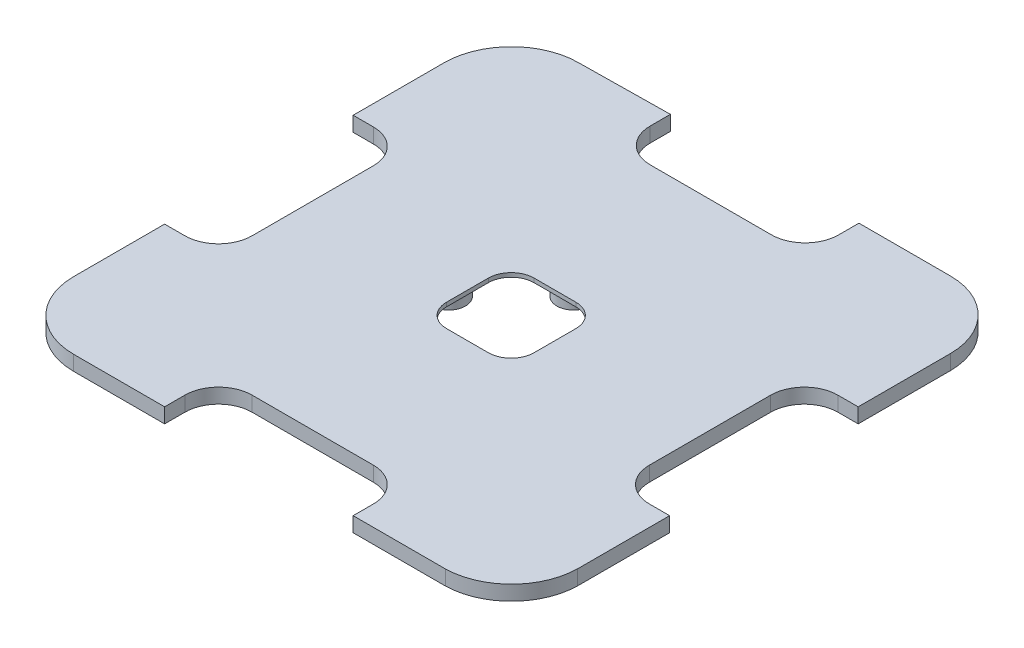
from build123d import *

# Parameters (mm, degrees)
SKETCH6_R           = 4.1
SKETCH6_R_2         = 1.85
SKETCH6_R_3         = 4
SKETCH6_R_4         = 5
BOSS_EXTRUDE3_DEPTH = 3.2
BOSS_EXTRUDE4_DEPTH = 1.2


with BuildPart() as part:
    # Sketch6 → Boss-Extrude3 (new body)
    # profile 1 of 85: a face of its own
    with BuildSketch(Plane(origin=(0, 0, 0), x_dir=(1, 0, 0), z_dir=(0, 1, 0))):
        with BuildLine():
            Line((-54.954364554, -74.989433444), (-27.954319602, -74.989433444))
            Line((-27.954319602, -74.989433444), (-27.954319602, -68.989433444))
            ThreePointArc((-27.954319602, -68.989433444), (-25.025387413, -61.918365632), (-17.954319602, -58.989433444))
            Line((-17.954319602, -58.989433444), (18.045680398, -58.989433444))
            ThreePointArc((18.045680398, -58.989433444), (25.11674821, -61.918365632), (28.045680398, -68.989433444))
            Line((28.045680398, -68.989433444), (28.045680398, -74.989433444))
            Line((28.045680398, -74.989433444), (55.511873427, -74.989433444))
            ThreePointArc((55.511873427, -74.989433444), (69.206726349, -69.094868813), (75.045680398, -55.376213472))
            Line((75.045680398, -55.376213472), (75.045680398, -27.989433444))
            Line((75.045680398, -27.989433444), (69.045680398, -27.989433444))
            ThreePointArc((69.045680398, -27.989433444), (61.974612587, -25.060501256), (59.045680398, -17.989433444))
            Line((59.045680398, -17.989433444), (59.045680398, 18.010566556))
            ThreePointArc((59.045680398, 18.010566556), (61.974612587, 25.081634368), (69.045680398, 28.010566556))
            Line((69.045680398, 28.010566556), (75.045680398, 28.010566556))
            Line((75.045680398, 28.010566556), (75.045680398, 55.370032289))
            ThreePointArc((75.045680398, 55.370032289), (69.187427099, 69.512575445), (55.04457266, 75.370077213))
            Line((55.04457266, 75.370077213), (27.921982461, 75.368635939))
            Line((27.921982461, 75.368635939), (27.922301297, 69.368635948))
            ThreePointArc((27.922301297, 69.368635948), (24.993744864, 62.297412505), (17.922832703, 59.36810457))
            Line((17.922832703, 59.36810457), (-18.077167246, 59.366191558))
            ThreePointArc((-18.077167246, 59.366191558), (-23.798086545, 61.163925869), (-27.461910519, 65.91125777))
            ThreePointArc((-27.461910519, 65.91125777), (-27.922501398, 67.611238944), (-28.077698624, 69.365660152))
            Line((-28.077698624, 69.365660152), (-28.07801746, 75.365660143))
            Line((-28.07801746, 75.365660143), (-54.92145734, 75.00005628))
            ThreePointArc((-54.92145734, 75.00005628), (-69.084833934, 69.153857035), (-74.954319602, 55.000114768))
            Line((-74.954319602, 55.000114768), (-74.954319602, 28.010566556))
            Line((-74.954319602, 28.010566556), (-68.954319602, 28.010566556))
            ThreePointArc((-68.954319602, 28.010566556), (-61.88325179, 25.081634368), (-58.954319602, 18.010566556))
            Line((-58.954319602, 18.010566556), (-58.954319602, -17.989433444))
            ThreePointArc((-58.954319602, -17.989433444), (-61.88325179, -25.060501256), (-68.954319602, -27.989433444))
            Line((-68.954319602, -27.989433444), (-74.954319602, -27.989433444))
            Line((-74.954319602, -27.989433444), (-74.954319602, -54.989478396))
            ThreePointArc((-74.954319602, -54.989478396), (-69.096468391, -69.131582234), (-54.954364554, -74.989433444))
        make_face()
        with BuildLine():
            Line((-73.454319602, 29.510566556), (-73.454319602, 55.000114768))
            ThreePointArc((-73.454319602, 55.000114768), (-68.021074061, 68.096289551), (-54.912699994, 73.500036434))
            Line((-54.912699994, 73.500036434), (-29.57793666, 73.845092336))
            Line((-29.57793666, 73.845092336), (-29.577698622, 69.365580443))
            ThreePointArc((-29.577698622, 69.365580443), (-26.208994497, 61.234031458), (-18.077087537, 57.86619156))
            Line((-18.077087537, 57.86619156), (17.922912412, 57.868104572))
            ThreePointArc((17.922912412, 57.868104572), (26.054461397, 61.236808697), (29.422301295, 69.368715657))
            Line((29.422301295, 69.368715657), (29.422062168, 73.86871565))
            Line((29.422062168, 73.86871565), (55.044652369, 73.870077215))
            ThreePointArc((55.044652369, 73.870077215), (68.126795109, 68.451887093), (73.545680398, 55.370032289))
            Line((73.545680398, 55.370032289), (73.545680398, 29.510566556))
            Line((73.545680398, 29.510566556), (69.045680398, 29.510566556))
            ThreePointArc((69.045680398, 29.510566556), (60.913952415, 26.142294539), (57.545680398, 18.010566556))
            Line((57.545680398, 18.010566556), (57.545680398, -17.989433444))
            ThreePointArc((57.545680398, -17.989433444), (60.913952415, -26.121161428), (69.045680398, -29.489433444))
            Line((69.045680398, -29.489433444), (73.545680398, -29.489433444))
            Line((73.545680398, -29.489433444), (73.545680398, -55.359832298))
            ThreePointArc((73.545680398, -55.359832298), (68.144969601, -68.035305217), (55.492389781, -73.489433444))
            Line((55.492389781, -73.489433444), (29.545680398, -73.489433444))
            Line((29.545680398, -73.489433444), (29.545680398, -68.989433444))
            ThreePointArc((29.545680398, -68.989433444), (26.177408382, -60.857705461), (18.045680398, -57.489433444))
            Line((18.045680398, -57.489433444), (-17.954319602, -57.489433444))
            ThreePointArc((-17.954319602, -57.489433444), (-26.086047585, -60.857705461), (-29.454319602, -68.989433444))
            Line((-29.454319602, -68.989433444), (-29.454319602, -73.489433444))
            Line((-29.454319602, -73.489433444), (-54.954364554, -73.489433444))
            ThreePointArc((-54.954364554, -73.489433444), (-68.03580822, -68.070922062), (-73.454319602, -54.989478396))
            Line((-73.454319602, -54.989478396), (-73.454319602, -29.489433444))
            Line((-73.454319602, -29.489433444), (-68.954319602, -29.489433444))
            ThreePointArc((-68.954319602, -29.489433444), (-60.822591618, -26.121161428), (-57.454319602, -17.989433444))
            Line((-57.454319602, -17.989433444), (-57.454319602, 18.010566556))
            ThreePointArc((-57.454319602, 18.010566556), (-60.822591618, 26.142294539), (-68.954319602, 29.510566556))
            Line((-68.954319602, 29.510566556), (-73.454319602, 29.510566556))
        make_face(mode=Mode.SUBTRACT)
    # profile 2 of 85: a face of its own
    with BuildSketch(Plane(origin=(0, 0, 0), x_dir=(1, 0, 0), z_dir=(0, 1, 0))):
        with BuildLine():
            ThreePointArc((-55.258923492, 58.988516932), (-57.040422597, 68.824154739), (-55.840270587, 58.900791132))
            ThreePointArc((-55.840270587, 58.900791132), (-57.747454065, 57.863456958), (-58.831826365, 55.982619985))
            ThreePointArc((-58.831826365, 55.982619985), (-68.753088955, 57.180513649), (-58.945846361, 55.261036292))
            ThreePointArc((-58.945846361, 55.261036292), (-52.110508104, 52.187215135), (-55.258923492, 58.988516932))
        make_face()
        with Locations((-63.814364554, 56.400128304)):
            Circle(SKETCH6_R, mode=Mode.SUBTRACT)
        with Locations((-54.954364554, 55.000128304)):
            Circle(SKETCH6_R_2, mode=Mode.SUBTRACT)
        with Locations((-56.294364554, 63.880128304)):
            Circle(SKETCH6_R, mode=Mode.SUBTRACT)
    # profile 3 of 85: a face of its own
    with BuildSketch(Plane(origin=(0, 0, 0), x_dir=(1, 0, 0), z_dir=(0, 1, 0))):
        with Locations((-17.000044952, 17.000224653)):
            Circle(SKETCH6_R_3)
        with Locations((-17.000044952, 17.000224653)):
            Circle(SKETCH6_R_2, mode=Mode.SUBTRACT)
    # profile 4 of 85: a face of its own
    with BuildSketch(Plane(origin=(0, 0, 0), x_dir=(1, 0, 0), z_dir=(0, 1, 0))):
        with Locations((-17.000044952, -16.999775347)):
            Circle(SKETCH6_R_3)
        with Locations((-17.000044952, -16.999775347)):
            Circle(SKETCH6_R_2, mode=Mode.SUBTRACT)
    # profile 5 of 85: a face of its own
    with BuildSketch(Plane(origin=(0, 0, 0), x_dir=(1, 0, 0), z_dir=(0, 1, 0))):
        with BuildLine():
            ThreePointArc((-55.938318133, -58.86654832), (-57.134773065, -68.787929532), (-55.213798486, -58.98103572))
            ThreePointArc((-55.213798486, -58.98103572), (-52.141894921, -52.145212163), (-58.94275318, -55.29376773))
            ThreePointArc((-58.94275318, -55.29376773), (-68.778413132, -57.075120071), (-58.855000429, -55.875410449))
            ThreePointArc((-58.855000429, -55.875410449), (-57.818195899, -57.782023089), (-55.938318133, -58.86654832))
        make_face()
        with Locations((-56.354364552, -63.849208791)):
            Circle(SKETCH6_R, mode=Mode.SUBTRACT)
        with Locations((-63.834364552, -56.329208791)):
            Circle(SKETCH6_R, mode=Mode.SUBTRACT)
        with Locations((-54.954364554, -54.989478396)):
            Circle(SKETCH6_R_2, mode=Mode.SUBTRACT)
    # profile 6 of 85: a face of its own
    with BuildSketch(Plane(origin=(0, 0, 0), x_dir=(1, 0, 0), z_dir=(0, 1, 0))):
        with Locations((16.999955048, -16.999775347)):
            Circle(SKETCH6_R_3)
        with Locations((16.999955048, -16.999775347)):
            Circle(SKETCH6_R_2, mode=Mode.SUBTRACT)
    # profile 7 of 85: a face of its own
    with BuildSketch(Plane(origin=(0, 0, 0), x_dir=(1, 0, 0), z_dir=(0, 1, 0))):
        with BuildLine():
            ThreePointArc((55.305652161, -58.935094765), (57.087176889, -68.770728706), (55.886947644, -58.847373672))
            ThreePointArc((55.886947644, -58.847373672), (57.794231807, -57.809945824), (58.878576703, -55.928939294))
            ThreePointArc((58.878576703, -55.928939294), (68.799818323, -57.127087058), (58.992513893, -55.207875457))
            ThreePointArc((58.992513893, -55.207875457), (52.15726306, -52.13371556), (55.305652161, -58.935094765))
        make_face()
        with Locations((56.341093222, -63.826706137)):
            Circle(SKETCH6_R, mode=Mode.SUBTRACT)
        with Locations((63.861093222, -56.346706137)):
            Circle(SKETCH6_R, mode=Mode.SUBTRACT)
        with Locations((55.001046261, -54.946706852)):
            Circle(SKETCH6_R_2, mode=Mode.SUBTRACT)
    # profile 8 of 85: a face of its own
    with BuildSketch(Plane(origin=(0, 0, 0), x_dir=(1, 0, 0), z_dir=(0, 1, 0))):
        with Locations((16.999955048, 17.000224653)):
            Circle(SKETCH6_R_3)
        with Locations((16.999955048, 17.000224653)):
            Circle(SKETCH6_R_2, mode=Mode.SUBTRACT)
    # profile 9 of 85: a face of its own
    with BuildSketch(Plane(origin=(0, 0, 0), x_dir=(1, 0, 0), z_dir=(0, 1, 0))):
        with BuildLine():
            ThreePointArc((56.028127127, 59.2474941), (57.226020792, 69.16875669), (55.306543434, 59.361514097))
            ThreePointArc((55.306543434, 59.361514097), (52.232722278, 52.526175839), (59.034024075, 55.674591228))
            ThreePointArc((59.034024075, 55.674591228), (68.869661882, 57.456090332), (58.946298275, 56.255938322))
            ThreePointArc((58.946298275, 56.255938322), (57.908964101, 58.1631218), (56.028127127, 59.2474941))
        make_face()
        with Locations((55.045635446, 55.370032289)):
            Circle(SKETCH6_R_2, mode=Mode.SUBTRACT)
        with Locations((63.925635446, 56.710032289)):
            Circle(SKETCH6_R, mode=Mode.SUBTRACT)
        with Locations((56.445635446, 64.230032289)):
            Circle(SKETCH6_R, mode=Mode.SUBTRACT)
    # profile 10 of 85: a face of its own
    with BuildSketch(Plane(origin=(0, 0, 0), x_dir=(1, 0, 0), z_dir=(0, 1, 0))):
        with Locations((-45.500044952, 65.000224653)):
            Circle(SKETCH6_R_4)
        with Locations((-45.500044952, 65.000224653)):
            Circle(SKETCH6_R, mode=Mode.SUBTRACT)
    # profile 11 of 85: a face of its own
    with BuildSketch(Plane(origin=(0, 0, 0), x_dir=(1, 0, 0), z_dir=(0, 1, 0))):
        with Locations((-33.770044952, 60.560224653)):
            Circle(SKETCH6_R_4)
        with Locations((-33.770044952, 60.560224653)):
            Circle(SKETCH6_R, mode=Mode.SUBTRACT)
    # profile 12 of 85: a face of its own
    with BuildSketch(Plane(origin=(0, 0, 0), x_dir=(1, 0, 0), z_dir=(0, 1, 0))):
        with Locations((-22.730044952, 52.090224653)):
            Circle(SKETCH6_R_4)
        with Locations((-22.730044952, 52.090224653)):
            Circle(SKETCH6_R, mode=Mode.SUBTRACT)
    # profile 13 of 85: a face of its own
    with BuildSketch(Plane(origin=(0, 0, 0), x_dir=(1, 0, 0), z_dir=(0, 1, 0))):
        with Locations((-10.970044952, 52.090224653)):
            Circle(SKETCH6_R_4)
        with Locations((-10.970044952, 52.090224653)):
            Circle(SKETCH6_R, mode=Mode.SUBTRACT)
    # profile 14 of 85: a face of its own
    with BuildSketch(Plane(origin=(0, 0, 0), x_dir=(1, 0, 0), z_dir=(0, 1, 0))):
        with Locations((-4.4952e-05, 52.090224653)):
            Circle(SKETCH6_R_4)
        with Locations((-4.4952e-05, 52.090224653)):
            Circle(SKETCH6_R, mode=Mode.SUBTRACT)
    # profile 15 of 85: a face of its own
    with BuildSketch(Plane(origin=(0, 0, 0), x_dir=(1, 0, 0), z_dir=(0, 1, 0))):
        with Locations((10.969955048, 52.090224653)):
            Circle(SKETCH6_R_4)
        with Locations((10.969955048, 52.090224653)):
            Circle(SKETCH6_R, mode=Mode.SUBTRACT)
    # profile 16 of 85: a face of its own
    with BuildSketch(Plane(origin=(0, 0, 0), x_dir=(1, 0, 0), z_dir=(0, 1, 0))):
        with Locations((33.859955048, 60.620224653)):
            Circle(SKETCH6_R_4)
        with Locations((33.859955048, 60.620224653)):
            Circle(SKETCH6_R, mode=Mode.SUBTRACT)
    # profile 17 of 85: a face of its own
    with BuildSketch(Plane(origin=(0, 0, 0), x_dir=(1, 0, 0), z_dir=(0, 1, 0))):
        with Locations((45.569955048, 65.000224653)):
            Circle(SKETCH6_R_4)
        with Locations((45.569955048, 65.000224653)):
            Circle(SKETCH6_R, mode=Mode.SUBTRACT)
    # profile 18 of 85: a face of its own
    with BuildSketch(Plane(origin=(0, 0, 0), x_dir=(1, 0, 0), z_dir=(0, 1, 0))):
        with Locations((64.999955048, 45.500224653)):
            Circle(SKETCH6_R_4)
        with Locations((64.999955048, 45.500224653)):
            Circle(SKETCH6_R, mode=Mode.SUBTRACT)
    # profile 19 of 85: a face of its own
    with BuildSketch(Plane(origin=(0, 0, 0), x_dir=(1, 0, 0), z_dir=(0, 1, 0))):
        with Locations((47.059955048, 47.060224653)):
            Circle(SKETCH6_R_4)
        with Locations((47.059955048, 47.060224653)):
            Circle(SKETCH6_R, mode=Mode.SUBTRACT)
    # profile 20 of 85: a face of its own
    with BuildSketch(Plane(origin=(0, 0, 0), x_dir=(1, 0, 0), z_dir=(0, 1, 0))):
        with Locations((39.629955048, 39.630224653)):
            Circle(SKETCH6_R_4)
        with Locations((39.629955048, 39.630224653)):
            Circle(SKETCH6_R, mode=Mode.SUBTRACT)
    # profile 21 of 85: a face of its own
    with BuildSketch(Plane(origin=(0, 0, 0), x_dir=(1, 0, 0), z_dir=(0, 1, 0))):
        with Locations((22.829955048, 52.090224653)):
            Circle(SKETCH6_R_4)
        with Locations((22.829955048, 52.090224653)):
            Circle(SKETCH6_R, mode=Mode.SUBTRACT)
    # profile 22 of 85: a face of its own
    with BuildSketch(Plane(origin=(0, 0, 0), x_dir=(1, 0, 0), z_dir=(0, 1, 0))):
        with Locations((13.309955048, 41.090224653)):
            Circle(SKETCH6_R_4)
        with Locations((13.309955048, 41.090224653)):
            Circle(SKETCH6_R, mode=Mode.SUBTRACT)
    # profile 23 of 85: a face of its own
    with BuildSketch(Plane(origin=(0, 0, 0), x_dir=(1, 0, 0), z_dir=(0, 1, 0))):
        with Locations((-4.4952e-05, 41.120224653)):
            Circle(SKETCH6_R_4)
        with Locations((-4.4952e-05, 41.120224653)):
            Circle(SKETCH6_R, mode=Mode.SUBTRACT)
    # profile 24 of 85: a face of its own
    with BuildSketch(Plane(origin=(0, 0, 0), x_dir=(1, 0, 0), z_dir=(0, 1, 0))):
        with Locations((-13.210044952, 40.960224653)):
            Circle(SKETCH6_R_4)
        with Locations((-13.210044952, 40.960224653)):
            Circle(SKETCH6_R, mode=Mode.SUBTRACT)
    # profile 25 of 85: a face of its own
    with BuildSketch(Plane(origin=(0, 0, 0), x_dir=(1, 0, 0), z_dir=(0, 1, 0))):
        with Locations((-5.580044952, 29.210224653)):
            Circle(SKETCH6_R_4)
        with Locations((-5.580044952, 29.210224653)):
            Circle(SKETCH6_R, mode=Mode.SUBTRACT)
    # profile 26 of 85: a face of its own
    with BuildSketch(Plane(origin=(0, 0, 0), x_dir=(1, 0, 0), z_dir=(0, 1, 0))):
        with Locations((5.679955048, 29.370224653)):
            Circle(SKETCH6_R_4)
        with Locations((5.679955048, 29.370224653)):
            Circle(SKETCH6_R, mode=Mode.SUBTRACT)
    # profile 27 of 85: a face of its own
    with BuildSketch(Plane(origin=(0, 0, 0), x_dir=(1, 0, 0), z_dir=(0, 1, 0))):
        with Locations((-4.4952e-05, 18.580224653)):
            Circle(SKETCH6_R_4)
        with Locations((-4.4952e-05, 18.580224653)):
            Circle(SKETCH6_R, mode=Mode.SUBTRACT)
    # profile 28 of 85: a face of its own
    with BuildSketch(Plane(origin=(0, 0, 0), x_dir=(1, 0, 0), z_dir=(0, 1, 0))):
        with Locations((-47.060044952, 47.060224653)):
            Circle(SKETCH6_R_4)
        with Locations((-47.060044952, 47.060224653)):
            Circle(SKETCH6_R, mode=Mode.SUBTRACT)
    # profile 29 of 85: a face of its own
    with BuildSketch(Plane(origin=(0, 0, 0), x_dir=(1, 0, 0), z_dir=(0, 1, 0))):
        with Locations((-39.630044952, 39.630224653)):
            Circle(SKETCH6_R_4)
        with Locations((-39.630044952, 39.630224653)):
            Circle(SKETCH6_R, mode=Mode.SUBTRACT)
    # profile 30 of 85: a face of its own
    with BuildSketch(Plane(origin=(0, 0, 0), x_dir=(1, 0, 0), z_dir=(0, 1, 0))):
        with Locations((-32.200044952, 32.200224653)):
            Circle(SKETCH6_R_4)
        with Locations((-32.200044952, 32.200224653)):
            Circle(SKETCH6_R, mode=Mode.SUBTRACT)
    # profile 31 of 85: a face of its own
    with BuildSketch(Plane(origin=(0, 0, 0), x_dir=(1, 0, 0), z_dir=(0, 1, 0))):
        with Locations((-24.770044952, 24.770224653)):
            Circle(SKETCH6_R_4)
        with Locations((-24.770044952, 24.770224653)):
            Circle(SKETCH6_R, mode=Mode.SUBTRACT)
    # profile 32 of 85: a face of its own
    with BuildSketch(Plane(origin=(0, 0, 0), x_dir=(1, 0, 0), z_dir=(0, 1, 0))):
        with Locations((-65.000044952, 45.570224653)):
            Circle(SKETCH6_R_4)
        with Locations((-65.000044952, 45.570224653)):
            Circle(SKETCH6_R, mode=Mode.SUBTRACT)
    # profile 33 of 85: a face of its own
    with BuildSketch(Plane(origin=(0, 0, 0), x_dir=(1, 0, 0), z_dir=(0, 1, 0))):
        with Locations((-60.620044952, 33.860224653)):
            Circle(SKETCH6_R_4)
        with Locations((-60.620044952, 33.860224653)):
            Circle(SKETCH6_R, mode=Mode.SUBTRACT)
    # profile 34 of 85: a face of its own
    with BuildSketch(Plane(origin=(0, 0, 0), x_dir=(1, 0, 0), z_dir=(0, 1, 0))):
        with Locations((-52.090044952, 22.830224653)):
            Circle(SKETCH6_R_4)
        with Locations((-52.090044952, 22.830224653)):
            Circle(SKETCH6_R, mode=Mode.SUBTRACT)
    # profile 35 of 85: a face of its own
    with BuildSketch(Plane(origin=(0, 0, 0), x_dir=(1, 0, 0), z_dir=(0, 1, 0))):
        with Locations((-41.090044952, 13.310224653)):
            Circle(SKETCH6_R_4)
        with Locations((-41.090044952, 13.310224653)):
            Circle(SKETCH6_R, mode=Mode.SUBTRACT)
    # profile 36 of 85: a face of its own
    with BuildSketch(Plane(origin=(0, 0, 0), x_dir=(1, 0, 0), z_dir=(0, 1, 0))):
        with Locations((-52.090044952, 10.970224653)):
            Circle(SKETCH6_R_4)
        with Locations((-52.090044952, 10.970224653)):
            Circle(SKETCH6_R, mode=Mode.SUBTRACT)
    # profile 37 of 85: a face of its own
    with BuildSketch(Plane(origin=(0, 0, 0), x_dir=(1, 0, 0), z_dir=(0, 1, 0))):
        with Locations((-52.090044952, 0.000224653)):
            Circle(SKETCH6_R_4)
        with Locations((-52.090044952, 0.000224653)):
            Circle(SKETCH6_R, mode=Mode.SUBTRACT)
    # profile 38 of 85: a face of its own
    with BuildSketch(Plane(origin=(0, 0, 0), x_dir=(1, 0, 0), z_dir=(0, 1, 0))):
        with Locations((-41.120044952, 0.000224653)):
            Circle(SKETCH6_R_4)
        with Locations((-41.120044952, 0.000224653)):
            Circle(SKETCH6_R, mode=Mode.SUBTRACT)
    # profile 39 of 85: a face of its own
    with BuildSketch(Plane(origin=(0, 0, 0), x_dir=(1, 0, 0), z_dir=(0, 1, 0))):
        with Locations((-29.370044952, 5.680224653)):
            Circle(SKETCH6_R_4)
        with Locations((-29.370044952, 5.680224653)):
            Circle(SKETCH6_R, mode=Mode.SUBTRACT)
    # profile 40 of 85: a face of its own
    with BuildSketch(Plane(origin=(0, 0, 0), x_dir=(1, 0, 0), z_dir=(0, 1, 0))):
        with Locations((-18.580044952, 0.000224653)):
            Circle(SKETCH6_R_4)
        with Locations((-18.580044952, 0.000224653)):
            Circle(SKETCH6_R, mode=Mode.SUBTRACT)
    # profile 41 of 85: a face of its own
    with BuildSketch(Plane(origin=(0, 0, 0), x_dir=(1, 0, 0), z_dir=(0, 1, 0))):
        with Locations((-29.210044952, -5.579775347)):
            Circle(SKETCH6_R_4)
        with Locations((-29.210044952, -5.579775347)):
            Circle(SKETCH6_R, mode=Mode.SUBTRACT)
    # profile 42 of 85: a face of its own
    with BuildSketch(Plane(origin=(0, 0, 0), x_dir=(1, 0, 0), z_dir=(0, 1, 0))):
        with Locations((-40.960044952, -13.209775347)):
            Circle(SKETCH6_R_4)
        with Locations((-40.960044952, -13.209775347)):
            Circle(SKETCH6_R, mode=Mode.SUBTRACT)
    # profile 43 of 85: a face of its own
    with BuildSketch(Plane(origin=(0, 0, 0), x_dir=(1, 0, 0), z_dir=(0, 1, 0))):
        with Locations((-52.090044952, -10.969775347)):
            Circle(SKETCH6_R_4)
        with Locations((-52.090044952, -10.969775347)):
            Circle(SKETCH6_R, mode=Mode.SUBTRACT)
    # profile 44 of 85: a face of its own
    with BuildSketch(Plane(origin=(0, 0, 0), x_dir=(1, 0, 0), z_dir=(0, 1, 0))):
        with Locations((-52.090044952, -22.729775347)):
            Circle(SKETCH6_R_4)
        with Locations((-52.090044952, -22.729775347)):
            Circle(SKETCH6_R, mode=Mode.SUBTRACT)
    # profile 45 of 85: a face of its own
    with BuildSketch(Plane(origin=(0, 0, 0), x_dir=(1, 0, 0), z_dir=(0, 1, 0))):
        with Locations((-60.560044952, -33.769775347)):
            Circle(SKETCH6_R_4)
        with Locations((-60.560044952, -33.769775347)):
            Circle(SKETCH6_R, mode=Mode.SUBTRACT)
    # profile 46 of 85: a face of its own
    with BuildSketch(Plane(origin=(0, 0, 0), x_dir=(1, 0, 0), z_dir=(0, 1, 0))):
        with Locations((-65.000044952, -45.499775347)):
            Circle(SKETCH6_R_4)
        with Locations((-65.000044952, -45.499775347)):
            Circle(SKETCH6_R, mode=Mode.SUBTRACT)
    # profile 47 of 85: a face of its own
    with BuildSketch(Plane(origin=(0, 0, 0), x_dir=(1, 0, 0), z_dir=(0, 1, 0))):
        with Locations((-45.570044952, -64.999775347)):
            Circle(SKETCH6_R_4)
        with Locations((-45.570044952, -64.999775347)):
            Circle(SKETCH6_R, mode=Mode.SUBTRACT)
    # profile 48 of 85: a face of its own
    with BuildSketch(Plane(origin=(0, 0, 0), x_dir=(1, 0, 0), z_dir=(0, 1, 0))):
        with Locations((-47.060044952, -47.059775347)):
            Circle(SKETCH6_R_4)
        with Locations((-47.060044952, -47.059775347)):
            Circle(SKETCH6_R, mode=Mode.SUBTRACT)
    # profile 49 of 85: a face of its own
    with BuildSketch(Plane(origin=(0, 0, 0), x_dir=(1, 0, 0), z_dir=(0, 1, 0))):
        with Locations((-33.860044952, -60.619775347)):
            Circle(SKETCH6_R_4)
        with Locations((-33.860044952, -60.619775347)):
            Circle(SKETCH6_R, mode=Mode.SUBTRACT)
    # profile 50 of 85: a face of its own
    with BuildSketch(Plane(origin=(0, 0, 0), x_dir=(1, 0, 0), z_dir=(0, 1, 0))):
        with Locations((-22.830044952, -52.089775347)):
            Circle(SKETCH6_R_4)
        with Locations((-22.830044952, -52.089775347)):
            Circle(SKETCH6_R, mode=Mode.SUBTRACT)
    # profile 51 of 85: a face of its own
    with BuildSketch(Plane(origin=(0, 0, 0), x_dir=(1, 0, 0), z_dir=(0, 1, 0))):
        with Locations((-39.630044952, -39.629775347)):
            Circle(SKETCH6_R_4)
        with Locations((-39.630044952, -39.629775347)):
            Circle(SKETCH6_R, mode=Mode.SUBTRACT)
    # profile 52 of 85: a face of its own
    with BuildSketch(Plane(origin=(0, 0, 0), x_dir=(1, 0, 0), z_dir=(0, 1, 0))):
        with Locations((-32.200044952, -32.199775347)):
            Circle(SKETCH6_R_4)
        with Locations((-32.200044952, -32.199775347)):
            Circle(SKETCH6_R, mode=Mode.SUBTRACT)
    # profile 53 of 85: a face of its own
    with BuildSketch(Plane(origin=(0, 0, 0), x_dir=(1, 0, 0), z_dir=(0, 1, 0))):
        with Locations((-24.770044952, -24.769775347)):
            Circle(SKETCH6_R_4)
        with Locations((-24.770044952, -24.769775347)):
            Circle(SKETCH6_R, mode=Mode.SUBTRACT)
    # profile 54 of 85: a face of its own
    with BuildSketch(Plane(origin=(0, 0, 0), x_dir=(1, 0, 0), z_dir=(0, 1, 0))):
        with Locations((-4.4952e-05, -18.579775347)):
            Circle(SKETCH6_R_4)
        with Locations((-4.4952e-05, -18.579775347)):
            Circle(SKETCH6_R, mode=Mode.SUBTRACT)
    # profile 55 of 85: a face of its own
    with BuildSketch(Plane(origin=(0, 0, 0), x_dir=(1, 0, 0), z_dir=(0, 1, 0))):
        with Locations((-5.680044952, -29.369775347)):
            Circle(SKETCH6_R_4)
        with Locations((-5.680044952, -29.369775347)):
            Circle(SKETCH6_R, mode=Mode.SUBTRACT)
    # profile 56 of 85: a face of its own
    with BuildSketch(Plane(origin=(0, 0, 0), x_dir=(1, 0, 0), z_dir=(0, 1, 0))):
        with Locations((5.579955048, -29.209775347)):
            Circle(SKETCH6_R_4)
        with Locations((5.579955048, -29.209775347)):
            Circle(SKETCH6_R, mode=Mode.SUBTRACT)
    # profile 57 of 85: a face of its own
    with BuildSketch(Plane(origin=(0, 0, 0), x_dir=(1, 0, 0), z_dir=(0, 1, 0))):
        with Locations((-13.210044952, -41.119775347)):
            Circle(SKETCH6_R_4)
        with Locations((-13.210044952, -41.119775347)):
            Circle(SKETCH6_R, mode=Mode.SUBTRACT)
    # profile 58 of 85: a face of its own
    with BuildSketch(Plane(origin=(0, 0, 0), x_dir=(1, 0, 0), z_dir=(0, 1, 0))):
        with Locations((-10.970044952, -52.089775347)):
            Circle(SKETCH6_R_4)
        with Locations((-10.970044952, -52.089775347)):
            Circle(SKETCH6_R, mode=Mode.SUBTRACT)
    # profile 59 of 85: a face of its own
    with BuildSketch(Plane(origin=(0, 0, 0), x_dir=(1, 0, 0), z_dir=(0, 1, 0))):
        with Locations((-4.4952e-05, -51.999775347)):
            Circle(SKETCH6_R_4)
        with Locations((-4.4952e-05, -51.999775347)):
            Circle(SKETCH6_R, mode=Mode.SUBTRACT)
    # profile 60 of 85: a face of its own
    with BuildSketch(Plane(origin=(0, 0, 0), x_dir=(1, 0, 0), z_dir=(0, 1, 0))):
        with Locations((10.969955048, -52.089775347)):
            Circle(SKETCH6_R_4)
        with Locations((10.969955048, -52.089775347)):
            Circle(SKETCH6_R, mode=Mode.SUBTRACT)
    # profile 61 of 85: a face of its own
    with BuildSketch(Plane(origin=(0, 0, 0), x_dir=(1, 0, 0), z_dir=(0, 1, 0))):
        with Locations((-4.4952e-05, -41.119775347)):
            Circle(SKETCH6_R_4)
        with Locations((-4.4952e-05, -41.119775347)):
            Circle(SKETCH6_R, mode=Mode.SUBTRACT)
    # profile 62 of 85: a face of its own
    with BuildSketch(Plane(origin=(0, 0, 0), x_dir=(1, 0, 0), z_dir=(0, 1, 0))):
        with Locations((13.209955048, -40.959775347)):
            Circle(SKETCH6_R_4)
        with Locations((13.209955048, -40.959775347)):
            Circle(SKETCH6_R, mode=Mode.SUBTRACT)
    # profile 63 of 85: a face of its own
    with BuildSketch(Plane(origin=(0, 0, 0), x_dir=(1, 0, 0), z_dir=(0, 1, 0))):
        with Locations((22.729955048, -52.089775347)):
            Circle(SKETCH6_R_4)
        with Locations((22.729955048, -52.089775347)):
            Circle(SKETCH6_R, mode=Mode.SUBTRACT)
    # profile 64 of 85: a face of its own
    with BuildSketch(Plane(origin=(0, 0, 0), x_dir=(1, 0, 0), z_dir=(0, 1, 0))):
        with Locations((33.769955048, -60.559775347)):
            Circle(SKETCH6_R_4)
        with Locations((33.769955048, -60.559775347)):
            Circle(SKETCH6_R, mode=Mode.SUBTRACT)
    # profile 65 of 85: a face of its own
    with BuildSketch(Plane(origin=(0, 0, 0), x_dir=(1, 0, 0), z_dir=(0, 1, 0))):
        with Locations((45.499955048, -64.999775347)):
            Circle(SKETCH6_R_4)
        with Locations((45.499955048, -64.999775347)):
            Circle(SKETCH6_R, mode=Mode.SUBTRACT)
    # profile 66 of 85: a face of its own
    with BuildSketch(Plane(origin=(0, 0, 0), x_dir=(1, 0, 0), z_dir=(0, 1, 0))):
        with Locations((47.059955048, -47.059775347)):
            Circle(SKETCH6_R_4)
        with Locations((47.059955048, -47.059775347)):
            Circle(SKETCH6_R, mode=Mode.SUBTRACT)
    # profile 67 of 85: a face of its own
    with BuildSketch(Plane(origin=(0, 0, 0), x_dir=(1, 0, 0), z_dir=(0, 1, 0))):
        with Locations((39.629955048, -39.629775347)):
            Circle(SKETCH6_R_4)
        with Locations((39.629955048, -39.629775347)):
            Circle(SKETCH6_R, mode=Mode.SUBTRACT)
    # profile 68 of 85: a face of its own
    with BuildSketch(Plane(origin=(0, 0, 0), x_dir=(1, 0, 0), z_dir=(0, 1, 0))):
        with Locations((32.199955048, -32.199775347)):
            Circle(SKETCH6_R_4)
        with Locations((32.199955048, -32.199775347)):
            Circle(SKETCH6_R, mode=Mode.SUBTRACT)
    # profile 69 of 85: a face of its own
    with BuildSketch(Plane(origin=(0, 0, 0), x_dir=(1, 0, 0), z_dir=(0, 1, 0))):
        with Locations((24.769955048, -24.769775347)):
            Circle(SKETCH6_R_4)
        with Locations((24.769955048, -24.769775347)):
            Circle(SKETCH6_R, mode=Mode.SUBTRACT)
    # profile 70 of 85: a face of its own
    with BuildSketch(Plane(origin=(0, 0, 0), x_dir=(1, 0, 0), z_dir=(0, 1, 0))):
        with Locations((64.999955048, -45.569775347)):
            Circle(SKETCH6_R_4)
        with Locations((64.999955048, -45.569775347)):
            Circle(SKETCH6_R, mode=Mode.SUBTRACT)
    # profile 71 of 85: a face of its own
    with BuildSketch(Plane(origin=(0, 0, 0), x_dir=(1, 0, 0), z_dir=(0, 1, 0))):
        with Locations((60.619955048, -33.859775347)):
            Circle(SKETCH6_R_4)
        with Locations((60.619955048, -33.859775347)):
            Circle(SKETCH6_R, mode=Mode.SUBTRACT)
    # profile 72 of 85: a face of its own
    with BuildSketch(Plane(origin=(0, 0, 0), x_dir=(1, 0, 0), z_dir=(0, 1, 0))):
        with Locations((52.089955048, -22.829775347)):
            Circle(SKETCH6_R_4)
        with Locations((52.089955048, -22.829775347)):
            Circle(SKETCH6_R, mode=Mode.SUBTRACT)
    # profile 73 of 85: a face of its own
    with BuildSketch(Plane(origin=(0, 0, 0), x_dir=(1, 0, 0), z_dir=(0, 1, 0))):
        with Locations((41.089955048, -13.309775347)):
            Circle(SKETCH6_R_4)
        with Locations((41.089955048, -13.309775347)):
            Circle(SKETCH6_R, mode=Mode.SUBTRACT)
    # profile 74 of 85: a face of its own
    with BuildSketch(Plane(origin=(0, 0, 0), x_dir=(1, 0, 0), z_dir=(0, 1, 0))):
        with Locations((52.089955048, -10.969775347)):
            Circle(SKETCH6_R_4)
        with Locations((52.089955048, -10.969775347)):
            Circle(SKETCH6_R, mode=Mode.SUBTRACT)
    # profile 75 of 85: a face of its own
    with BuildSketch(Plane(origin=(0, 0, 0), x_dir=(1, 0, 0), z_dir=(0, 1, 0))):
        with Locations((52.089955048, 0.000224653)):
            Circle(SKETCH6_R_4)
        with Locations((52.089955048, 0.000224653)):
            Circle(SKETCH6_R, mode=Mode.SUBTRACT)
    # profile 76 of 85: a face of its own
    with BuildSketch(Plane(origin=(0, 0, 0), x_dir=(1, 0, 0), z_dir=(0, 1, 0))):
        with Locations((41.119955048, 0.000224653)):
            Circle(SKETCH6_R_4)
        with Locations((41.119955048, 0.000224653)):
            Circle(SKETCH6_R, mode=Mode.SUBTRACT)
    # profile 77 of 85: a face of its own
    with BuildSketch(Plane(origin=(0, 0, 0), x_dir=(1, 0, 0), z_dir=(0, 1, 0))):
        with Locations((29.369955048, -5.679775347)):
            Circle(SKETCH6_R_4)
        with Locations((29.369955048, -5.679775347)):
            Circle(SKETCH6_R, mode=Mode.SUBTRACT)
    # profile 78 of 85: a face of its own
    with BuildSketch(Plane(origin=(0, 0, 0), x_dir=(1, 0, 0), z_dir=(0, 1, 0))):
        with Locations((18.579955048, 0.000224653)):
            Circle(SKETCH6_R_4)
        with Locations((18.579955048, 0.000224653)):
            Circle(SKETCH6_R, mode=Mode.SUBTRACT)
    # profile 79 of 85: a face of its own
    with BuildSketch(Plane(origin=(0, 0, 0), x_dir=(1, 0, 0), z_dir=(0, 1, 0))):
        with Locations((29.209955048, 5.580224653)):
            Circle(SKETCH6_R_4)
        with Locations((29.209955048, 5.580224653)):
            Circle(SKETCH6_R, mode=Mode.SUBTRACT)
    # profile 80 of 85: a face of its own
    with BuildSketch(Plane(origin=(0, 0, 0), x_dir=(1, 0, 0), z_dir=(0, 1, 0))):
        with Locations((40.959955048, 13.210224653)):
            Circle(SKETCH6_R_4)
        with Locations((40.959955048, 13.210224653)):
            Circle(SKETCH6_R, mode=Mode.SUBTRACT)
    # profile 81 of 85: a face of its own
    with BuildSketch(Plane(origin=(0, 0, 0), x_dir=(1, 0, 0), z_dir=(0, 1, 0))):
        with Locations((52.089955048, 10.970224653)):
            Circle(SKETCH6_R_4)
        with Locations((52.089955048, 10.970224653)):
            Circle(SKETCH6_R, mode=Mode.SUBTRACT)
    # profile 82 of 85: a face of its own
    with BuildSketch(Plane(origin=(0, 0, 0), x_dir=(1, 0, 0), z_dir=(0, 1, 0))):
        with Locations((52.089955048, 22.730224653)):
            Circle(SKETCH6_R_4)
        with Locations((52.089955048, 22.730224653)):
            Circle(SKETCH6_R, mode=Mode.SUBTRACT)
    # profile 83 of 85: a face of its own
    with BuildSketch(Plane(origin=(0, 0, 0), x_dir=(1, 0, 0), z_dir=(0, 1, 0))):
        with Locations((60.559955048, 33.770224653)):
            Circle(SKETCH6_R_4)
        with Locations((60.559955048, 33.770224653)):
            Circle(SKETCH6_R, mode=Mode.SUBTRACT)
    # profile 84 of 85: a face of its own
    with BuildSketch(Plane(origin=(0, 0, 0), x_dir=(1, 0, 0), z_dir=(0, 1, 0))):
        with Locations((32.199955048, 32.200224653)):
            Circle(SKETCH6_R_4)
        with Locations((32.199955048, 32.200224653)):
            Circle(SKETCH6_R, mode=Mode.SUBTRACT)
    # profile 85 of 85: a face of its own
    with BuildSketch(Plane(origin=(0, 0, 0), x_dir=(1, 0, 0), z_dir=(0, 1, 0))):
        with Locations((24.769955048, 24.770224653)):
            Circle(SKETCH6_R_4)
        with Locations((24.769955048, 24.770224653)):
            Circle(SKETCH6_R, mode=Mode.SUBTRACT)
    extrude(amount=BOSS_EXTRUDE3_DEPTH)

    # Sketch7 → Boss-Extrude4 (add)
    with BuildSketch(Plane(origin=(0, 3.2, 0), x_dir=(1, 0, 0), z_dir=(0, 1, 0))):
        with BuildLine():
            Line((69.045680398, 28.010566556), (75.045680398, 28.010566556))
            Line((75.045680398, 28.010566556), (75.045680398, 55.370032289))
            ThreePointArc((75.045680398, 55.370032289), (69.187427099, 69.512575445), (55.04457266, 75.370077213))
            Line((55.04457266, 75.370077213), (27.921982461, 75.368635939))
            Line((27.921982461, 75.368635939), (27.922301297, 69.368635948))
            ThreePointArc((27.922301297, 69.368635948), (24.993744864, 62.297412505), (17.922832703, 59.36810457))
            Line((17.922832703, 59.36810457), (-18.077167246, 59.366191558))
            ThreePointArc((-18.077167246, 59.366191558), (-25.148390689, 62.294747991), (-28.077698624, 69.365660152))
            Line((-28.077698624, 69.365660152), (-28.07801746, 75.365660143))
            Line((-28.07801746, 75.365660143), (-54.92145734, 75.00005628))
            ThreePointArc((-54.92145734, 75.00005628), (-69.084833934, 69.153857035), (-74.954319602, 55.000114768))
            Line((-74.954319602, 55.000114768), (-74.954319602, 28.010566556))
            Line((-74.954319602, 28.010566556), (-68.954319602, 28.010566556))
            ThreePointArc((-68.954319602, 28.010566556), (-61.88325179, 25.081634368), (-58.954319602, 18.010566556))
            Line((-58.954319602, 18.010566556), (-58.954319602, -17.989433444))
            ThreePointArc((-58.954319602, -17.989433444), (-61.88325179, -25.060501256), (-68.954319602, -27.989433444))
            Line((-68.954319602, -27.989433444), (-74.954319602, -27.989433444))
            Line((-74.954319602, -27.989433444), (-74.954319602, -54.989478396))
            ThreePointArc((-74.954319602, -54.989478396), (-69.096468391, -69.131582234), (-54.954364554, -74.989433444))
            Line((-54.954364554, -74.989433444), (-27.954319602, -74.989433444))
            Line((-27.954319602, -74.989433444), (-27.954319602, -68.989433444))
            ThreePointArc((-27.954319602, -68.989433444), (-25.025387413, -61.918365632), (-17.954319602, -58.989433444))
            Line((-17.954319602, -58.989433444), (18.045680398, -58.989433444))
            ThreePointArc((18.045680398, -58.989433444), (25.11674821, -61.918365632), (28.045680398, -68.989433444))
            Line((28.045680398, -68.989433444), (28.045680398, -74.989433444))
            Line((28.045680398, -74.989433444), (55.511873427, -74.989433444))
            ThreePointArc((55.511873427, -74.989433444), (69.206726349, -69.094868813), (75.045680398, -55.376213472))
            Line((75.045680398, -55.376213472), (75.045680398, -27.989433444))
            Line((75.045680398, -27.989433444), (69.045680398, -27.989433444))
            ThreePointArc((69.045680398, -27.989433444), (61.974612587, -25.060501256), (59.045680398, -17.989433444))
            Line((59.045680398, -17.989433444), (59.045680398, 18.010566556))
            ThreePointArc((59.045680398, 18.010566556), (61.974612587, 25.081634368), (69.045680398, 28.010566556))
        make_face()
        with BuildLine():
            Line((-6.2, -13), (6.2, -13))
            ThreePointArc((6.2, -13), (11.008326112, -11.008326112), (13, -6.2))
            Line((13, -6.2), (13, 6.2))
            ThreePointArc((13, 6.2), (11.008326112, 11.008326112), (6.2, 13))
            Line((6.2, 13), (-6.2, 13))
            ThreePointArc((-6.2, 13), (-11.008326112, 11.008326112), (-13, 6.2))
            Line((-13, 6.2), (-13, -6.2))
            ThreePointArc((-13, -6.2), (-11.008326112, -11.008326112), (-6.2, -13))
        make_face(mode=Mode.SUBTRACT)
    extrude(amount=BOSS_EXTRUDE4_DEPTH)


solid = part.part
